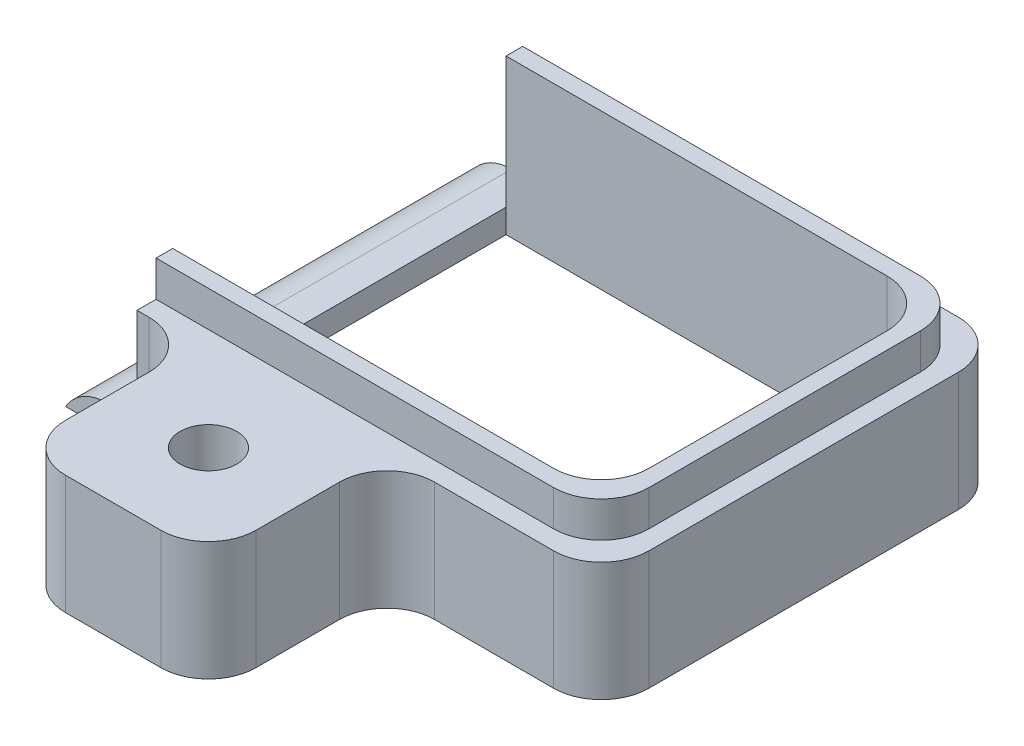
from build123d import *

# Parameters (mm, degrees)
SKETCH5_W                 = 11.25
SKETCH5_H                 = 8.5
EXTRUDE4_DEPTH            = 2.5
SKETCH19_W                = 1.5
SKETCH19_H                = 8.5
EXTRUDE12_DEPTH           = 2
SKETCH21_W                = 9
SKETCH21_H                = 7
EXTRUDE13_DEPTH           = 8.48018215
SKETCH22_W                = 4
SKETCH22_H                = 2.5
EXTRUDE14_DEPTH           = 3.75
EXTRUDE15_DEPTH           = 0.75
F_0_80_TAPPED_HOLE1_D     = 1.19126
F_0_80_TAPPED_HOLE1_DEPTH = 79.01
F_0_80_TAPPED_HOLE1_TIP   = 0.357890611
FILLET4_R                 = 1
FILLET5_R                 = 1


with BuildPart() as part:
    # Sketch5 → Extrude4 (new body)
    with BuildSketch(Plane(origin=(0, 0, 0), x_dir=(1, 0, 0), z_dir=(0, 1, 0))):
        Rectangle(SKETCH5_W, SKETCH5_H)
    extrude(amount=EXTRUDE4_DEPTH)

    # Sketch19 → Extrude12 (cut)
    with BuildSketch(Plane(origin=(0, 2.5, 0), x_dir=(-1, 0, 0), z_dir=(0, 1, 0))):
        with Locations((4.875, 0)):
            Rectangle(SKETCH19_W, SKETCH19_H)
    extrude(amount=-EXTRUDE12_DEPTH, mode=Mode.SUBTRACT)

    # Sketch21 → Extrude13 (cut, through all)
    with BuildSketch(Plane(origin=(0, 2.5, 0), x_dir=(-1, 0, 0), z_dir=(0, 1, 0))):
        with Locations((-0.375, 0)):
            Rectangle(SKETCH21_W, SKETCH21_H)
    extrude(amount=-EXTRUDE13_DEPTH, mode=Mode.SUBTRACT)

    # Sketch22 → Extrude14 (add)
    with BuildSketch(Plane.XY.offset(4.25)):
        with Locations((-0.875, 1.25)):
            Rectangle(SKETCH22_W, SKETCH22_H)
    extrude(amount=EXTRUDE14_DEPTH)

    # Sketch24 → Extrude15 (add)
    with BuildSketch(Plane(origin=(0, 2.5, 0), x_dir=(1, 0, 0), z_dir=(0, 1, 0))):
        Polygon((-4.125, 3.85), (-4.125, 3.5), (4.875, 3.5), (4.875, -3.5), (-4.125, -3.5), (-4.125, -3.85), (5.225, -3.85), (5.225, 3.85), align=None)
    extrude(amount=EXTRUDE15_DEPTH)

    # #0-80 Tapped Hole1
    with Locations(Plane(origin=(-0.875, 2.5, 6), x_dir=(0, 0, 1), z_dir=(0, 1, 0))):
        with Locations((0, 0)):
            Hole(F_0_80_TAPPED_HOLE1_D / 2, depth=F_0_80_TAPPED_HOLE1_DEPTH)
            with Locations((0, 0, -(F_0_80_TAPPED_HOLE1_DEPTH + F_0_80_TAPPED_HOLE1_TIP / 2))):  # 118° drill point
                Cone(0, F_0_80_TAPPED_HOLE1_D / 2, F_0_80_TAPPED_HOLE1_TIP, mode=Mode.SUBTRACT)

    # Fillet4
    fillet4_edges = [part.edges().sort_by_distance(p)[0] for p in [
        (5.625, 1.25, -4.25),
        (5.225, 2.875, -3.85),
        (5.625, 1.25, 4.25),
        (5.225, 2.875, 3.85),
        (-2.875, 1.25, 8),
        (1.125, 1.25, 8),
        (1.125, 1.25, 4.25),
        (-2.875, 1.25, 4.25),
        (4.875, 1.625, 3.5),
        (4.875, 1.625, -3.5),
    ]]
    fillet(fillet4_edges, radius=FILLET4_R)

    # Fillet5
    # the kernel refuses this fillet: 1 mm, written as the material it takes off along each edge
    with BuildSketch(Plane(origin=(-5.625, 0.5, 6.415063509), x_dir=(0, -1, 0), z_dir=(0, 0, -1))) as fillet5_piece_1:
        with BuildLine():
            CenterArc((1, -0.866025404), FILLET5_R, 120, 60)
            Line((0, -0.866025404), (-0.02, -0.866025404))
            Line((-0.02, -0.866025404), (-0.02, 0))
            Line((-0.02, 0), (0, 0.02))
            ThreePointArc((0, 0.02), (0.25, 0.02), (0.49, 0.017320508))
            Line((0.49, 0.017320508), (0.5, 0))
        make_face()
    extrude(amount=12.830127019, mode=Mode.SUBTRACT)


solid = part.part
